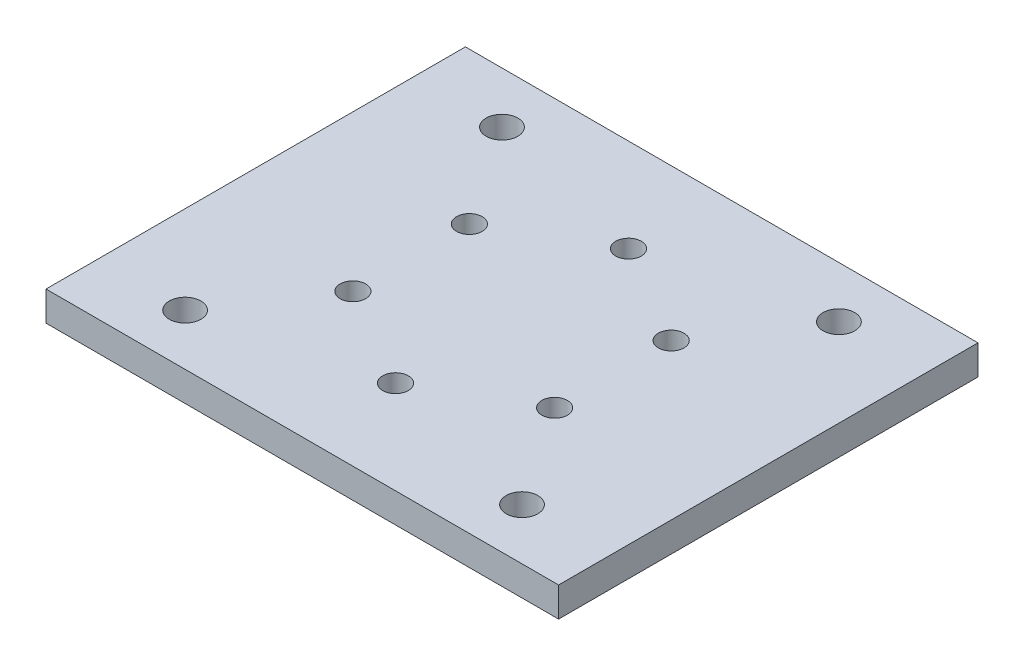
from build123d import *

# Parameters (mm, degrees)
SKETCH2_W            = 110
SKETCH2_H            = 90
BOSS_EXTRUDE1_DEPTH  = 6.35
SKETCH3_R            = 3.4
MOUNTING_HOLES_DEPTH = 143.268487375
SKETCH4_R            = 2.75
CUT_EXTRUDE1_DEPTH   = 143.268487375


with BuildPart() as part:
    # Sketch2 → Boss-Extrude1 (new body)
    with BuildSketch(Plane(origin=(0, 0, 0), x_dir=(1, 0, 0), z_dir=(0, 1, 0))):
        with Locations((55, 45)):
            Rectangle(SKETCH2_W, SKETCH2_H)
    extrude(amount=BOSS_EXTRUDE1_DEPTH)

    # Sketch3 → Mounting Holes (cut, through all)
    with BuildSketch(Plane(origin=(0, 6.35, 0), x_dir=(1, 0, 0), z_dir=(0, 1, 0))):
        with Locations((18.85, 79)):
            Circle(SKETCH3_R)
        with Locations((18.85, 11)):
            Circle(SKETCH3_R)
        with Locations((91.15, 11)):
            Circle(SKETCH3_R)
        with Locations((91.15, 79)):
            Circle(SKETCH3_R)
    extrude(amount=-MOUNTING_HOLES_DEPTH, mode=Mode.SUBTRACT)

    # Sketch4 → Cut-Extrude1 (cut, through all)
    with BuildSketch(Plane(origin=(0, 6.35, 0), x_dir=(1, 0, 0), z_dir=(0, 1, 0))):
        with Locations((55, 70)):
            Circle(SKETCH4_R)
        with Locations((76.650635095, 57.5)):
            Circle(SKETCH4_R)
        with Locations((76.650635095, 32.5)):
            Circle(SKETCH4_R)
        with Locations((55, 20)):
            Circle(SKETCH4_R)
        with Locations((33.349364905, 32.5)):
            Circle(SKETCH4_R)
        with Locations((33.349364905, 57.5)):
            Circle(SKETCH4_R)
    extrude(amount=-CUT_EXTRUDE1_DEPTH, mode=Mode.SUBTRACT)


solid = part.part
